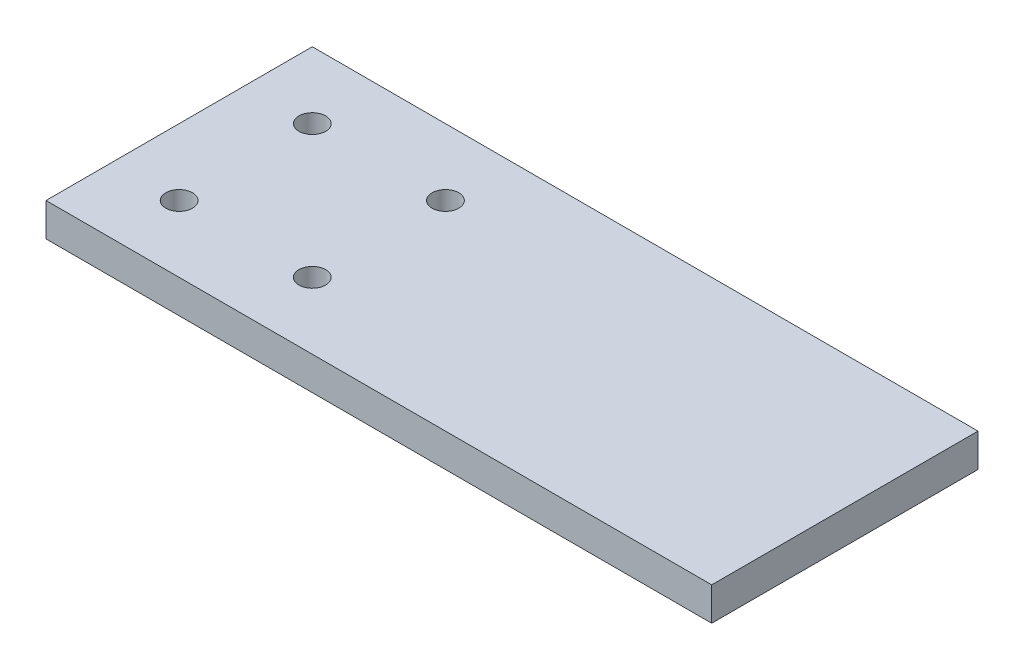
from build123d import *

# Parameters (mm, degrees)
BOSS_EXTRUDE1_DEPTH    = 6.35
F_10_CLEARANCE_HOLE1_D = 5.1054


with BuildPart() as part:
    # Sketch1 → Boss-Extrude1 (new body)
    with BuildSketch(Plane(origin=(0, 0, 0), x_dir=(1, 0, 0), z_dir=(0, 1, 0))):
        Polygon((50.8, 25.4), (76.2, 25.4), (76.2, -25.4), (50.8, -25.4), (-50.8, -25.4), (-50.8, 25.4), align=None)
    extrude(amount=BOSS_EXTRUDE1_DEPTH)

    # #10 Clearance Hole1 (through all)
    with Locations(Plane(origin=(0, 6.35, 0), x_dir=(1, 0, 0), z_dir=(0, 1, 0))):
        with Locations((-38.1, 12.7), (-12.7, 12.7), (-12.7, -12.7), (-38.1, -12.7)):
            Hole(F_10_CLEARANCE_HOLE1_D / 2)


solid = part.part
